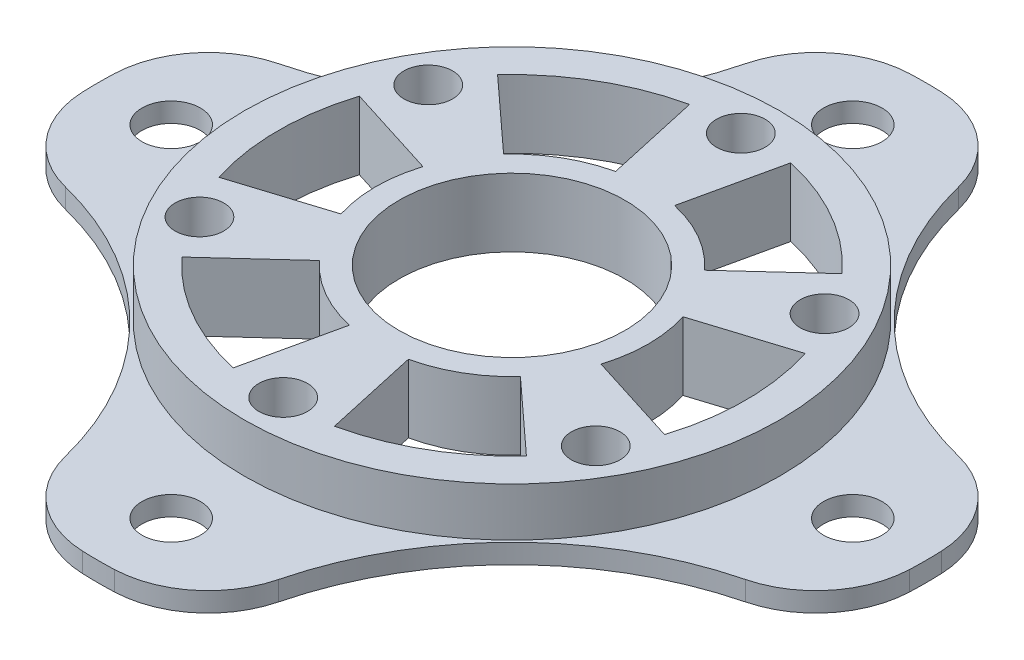
from build123d import *

# Parameters (mm, degrees)
SKETCH1_R           = 27.5
BOSS_EXTRUDE1_DEPTH = 5
SKETCH2_R           = 42.5
BOSS_EXTRUDE2_DEPTH = 2
SKETCH3_R           = 3
CUT_EXTRUDE1_DEPTH  = 2
SKETCH4_R           = 11.6
SKETCH4_R_2         = 2.5
CUT_EXTRUDE2_DEPTH  = 61.510329697
CUT_EXTRUDE3_DEPTH  = 61.510329697
FILLET1_R           = 10


with BuildPart() as part:
    # Sketch1 → Boss-Extrude1 (new body)
    with BuildSketch(Plane(origin=(0, 0, 0), x_dir=(1, 0, 0), z_dir=(0, 1, 0))):
        Circle(SKETCH1_R)
    extrude(amount=-BOSS_EXTRUDE1_DEPTH)

    # Sketch2 → Boss-Extrude2 (add)
    with BuildSketch(Plane.XZ.offset(5)):
        Circle(SKETCH2_R)
    extrude(amount=BOSS_EXTRUDE2_DEPTH)

    # Sketch3 → Cut-Extrude1 (cut)
    with BuildSketch(Plane(origin=(0, -5, 0), x_dir=(1, 0, 0), z_dir=(0, 1, 0))):
        with Locations((0, 35)):
            Circle(SKETCH3_R)
        with Locations((35, 0)):
            Circle(SKETCH3_R)
        with Locations((0, -35)):
            Circle(SKETCH3_R)
        with Locations((-35, 0)):
            Circle(SKETCH3_R)
        with BuildLine():
            ThreePointArc((-41.306779105, 10), (-19.624107624, 19.624107624), (-10, 41.306779105))
            ThreePointArc((-10, 41.306779105), (-30.0520382, 30.0520382), (-41.306779105, 10))
        make_face()
        with BuildLine():
            ThreePointArc((41.306779105, 10), (30.0520382, 30.0520382), (10, 41.306779105))
            ThreePointArc((10, 41.306779105), (19.624107624, 19.624107624), (41.306779105, 10))
        make_face()
        with BuildLine():
            ThreePointArc((-10, -41.306779105), (-19.624107624, -19.624107624), (-41.306779105, -10))
            ThreePointArc((-41.306779105, -10), (-30.0520382, -30.0520382), (-10, -41.306779105))
        make_face()
        with BuildLine():
            ThreePointArc((41.306779105, -10), (19.624107624, -19.624107624), (10, -41.306779105))
            ThreePointArc((10, -41.306779105), (30.0520382, -30.0520382), (41.306779105, -10))
        make_face()
    extrude(amount=-CUT_EXTRUDE1_DEPTH, mode=Mode.SUBTRACT)

    # Sketch4 → Cut-Extrude2 (cut, through all)
    with BuildSketch(Plane(origin=(0, 0, 0), x_dir=(1, 0, 0), z_dir=(0, 1, 0))):
        Circle(SKETCH4_R)
        with Locations((0, 23.5)):
            Circle(SKETCH4_R_2)
        with Locations((20.351596989, 11.75)):
            Circle(SKETCH4_R_2)
        with Locations((20.351596989, -11.75)):
            Circle(SKETCH4_R_2)
        with Locations((0, -23.5)):
            Circle(SKETCH4_R_2)
        with Locations((-20.351596989, -11.75)):
            Circle(SKETCH4_R_2)
        with Locations((-20.351596989, 11.75)):
            Circle(SKETCH4_R_2)
    extrude(amount=-CUT_EXTRUDE2_DEPTH, mode=Mode.SUBTRACT)

    # Sketch5 → Cut-Extrude3 (cut, through all)
    with BuildSketch(Plane(origin=(0, 0, 0), x_dir=(1, 0, 0), z_dir=(0, 1, 0))):
        with BuildLine():
            Line((-17.694656083, 16.214164983), (-10.321882715, 9.458262907))
            ThreePointArc((-10.321882715, 9.458262907), (-7, 12.124355653), (-3.030154595, 13.6681441))
            Line((-3.030154595, 13.6681441), (-5.194550735, 23.431104171))
            ThreePointArc((-5.194550735, 23.431104171), (-12, 20.784609691), (-17.694656083, 16.214164983))
        make_face()
        with BuildLine():
            Line((17.694656083, 16.214164983), (10.321882715, 9.458262907))
            ThreePointArc((10.321882715, 9.458262907), (7, 12.124355653), (3.030154595, 13.6681441))
            Line((3.030154595, 13.6681441), (5.194550735, 23.431104171))
            ThreePointArc((5.194550735, 23.431104171), (12, 20.784609691), (17.694656083, 16.214164983))
        make_face()
        with BuildLine():
            Line((22.889206818, -7.216939188), (13.35203731, -4.209881193))
            ThreePointArc((13.35203731, -4.209881193), (14, 0), (13.35203731, 4.209881193))
            Line((13.35203731, 4.209881193), (22.889206818, 7.216939188))
            ThreePointArc((22.889206818, 7.216939188), (24, 0), (22.889206818, -7.216939188))
        make_face()
        with BuildLine():
            Line((5.194550735, -23.431104171), (3.030154595, -13.6681441))
            ThreePointArc((3.030154595, -13.6681441), (7, -12.124355653), (10.321882715, -9.458262907))
            Line((10.321882715, -9.458262907), (17.694656083, -16.214164983))
            ThreePointArc((17.694656083, -16.214164983), (12, -20.784609691), (5.194550735, -23.431104171))
        make_face()
        with BuildLine():
            Line((-17.694656083, -16.214164983), (-10.321882715, -9.458262907))
            ThreePointArc((-10.321882715, -9.458262907), (-7, -12.124355653), (-3.030154595, -13.6681441))
            Line((-3.030154595, -13.6681441), (-5.194550735, -23.431104171))
            ThreePointArc((-5.194550735, -23.431104171), (-12, -20.784609691), (-17.694656083, -16.214164983))
        make_face()
        with BuildLine():
            Line((-22.889206818, 7.216939188), (-13.35203731, 4.209881193))
            ThreePointArc((-13.35203731, 4.209881193), (-14, 0), (-13.35203731, -4.209881193))
            Line((-13.35203731, -4.209881193), (-22.889206818, -7.216939188))
            ThreePointArc((-22.889206818, -7.216939188), (-24, 0), (-22.889206818, 7.216939188))
        make_face()
    extrude(amount=-CUT_EXTRUDE3_DEPTH, mode=Mode.SUBTRACT)

    # Fillet1
    fillet1_edges = [part.edges().sort_by_distance(p)[0] for p in [
        (10, -6, -41.306779105),
        (-10, -6, -41.306779105),
        (-41.306779105, -6, -10),
        (-41.306779105, -6, 10),
        (10, -6, 41.306779105),
        (-10, -6, 41.306779105),
        (41.306779105, -6, 10),
        (41.306779105, -6, -10),
    ]]
    fillet(fillet1_edges, radius=FILLET1_R)


solid = part.part
